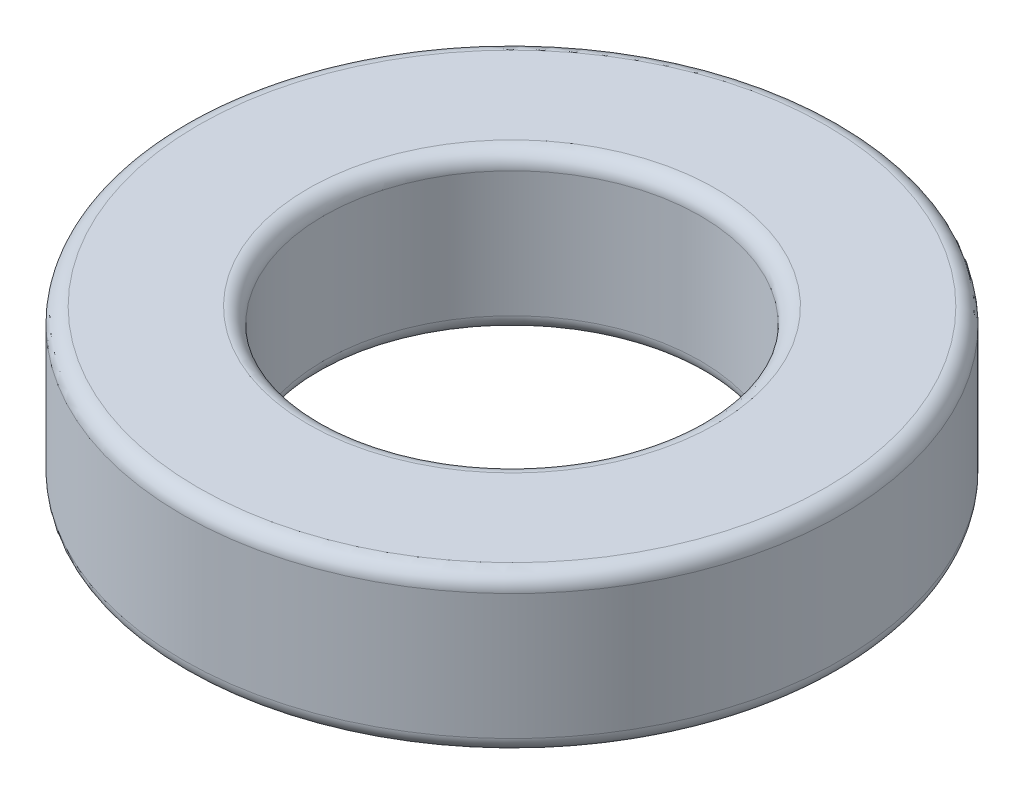
from build123d import *

# Parameters (mm, degrees)
SKETCH_1_R      = 10.5
SKETCH_1_R_2    = 6
EXTRUDE_1_DEPTH = 5
FILLET_1_R      = 0.5


with BuildPart() as part:
    # Эскиз1 → Бобышка-Вытянуть1 (new body)
    with BuildSketch(Plane(origin=(0, 0, 0), x_dir=(1, 0, 0), z_dir=(0, 1, 0))):
        Circle(SKETCH_1_R)
        Circle(SKETCH_1_R_2, mode=Mode.SUBTRACT)
    extrude(amount=EXTRUDE_1_DEPTH)

    # Скругление1
    fillet_1_edges = [part.edges().sort_by_distance(p)[0] for p in [
        (-6, 5, 0),
        (-6, 0, 0),
        (-10.5, 0, 0),
        (-10.5, 5, 0),
    ]]
    fillet(fillet_1_edges, radius=FILLET_1_R)


solid = part.part
